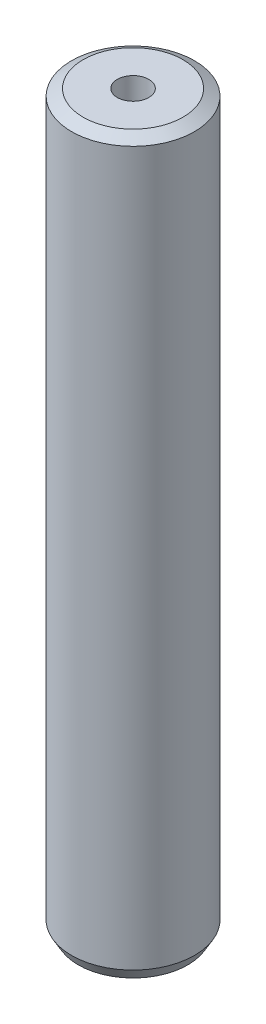
from build123d import *
from OCP.BRepFilletAPI import BRepFilletAPI_MakeChamfer

# Parameters (mm, degrees)
SKETCH1_R           = 7.5
BOSS_EXTRUDE1_DEPTH = 89.245535835
SKETCH2_R           = 1.921418219
CUT_EXTRUDE1_DEPTH  = 90.873609399
CHAMFER1_SIZE       = 0.815649787
CHAMFER1_SIZE2      = 1.412746872


with BuildPart() as part:
    # Sketch1 → Boss-Extrude1 (new body)
    with BuildSketch(Plane(origin=(0, 0, 0), x_dir=(1, 0, 0), z_dir=(0, 1, 0))):
        Circle(SKETCH1_R)
    extrude(amount=BOSS_EXTRUDE1_DEPTH)

    # Sketch2 → Cut-Extrude1 (cut, through all)
    with BuildSketch(Plane(origin=(0, 0, 0), x_dir=(1, 0, 0), z_dir=(0, 1, 0))):
        Circle(SKETCH2_R)
    extrude(amount=CUT_EXTRUDE1_DEPTH, mode=Mode.SUBTRACT)

    # Chamfer1: one chamfer whose edges measure the first distance from different faces: ONE call of the kernel's chamfer builder (chamfer() names one face for all edges)
    chamfer1_edges_1 = [part.edges().sort_by_distance(p)[0] for p in [
        (-7.5, 89.245535835, 0),
    ]]
    chamfer1_side_1 = [part.faces().sort_by_distance(p)[0] for p in [
        (-7.5, 44.622767917, 0),
    ]]
    chamfer1_edges_2 = [part.edges().sort_by_distance(p)[0] for p in [
        (-7.5, 0, 0),
    ]]
    chamfer1_side_2 = [part.faces().sort_by_distance(p)[0] for p in [
        (-7.287867966, 0, 0),
    ]]
    chamfer1 = BRepFilletAPI_MakeChamfer(part.part.solid().wrapped)
    for e in chamfer1_edges_1:
        chamfer1.Add(CHAMFER1_SIZE, CHAMFER1_SIZE2, e.wrapped, chamfer1_side_1[0].wrapped)  # the first distance lies on this face
    for e in chamfer1_edges_2:
        chamfer1.Add(CHAMFER1_SIZE, CHAMFER1_SIZE2, e.wrapped, chamfer1_side_2[0].wrapped)  # the first distance lies on this face
    add(Compound.cast(chamfer1.Shape()), mode=Mode.REPLACE)


solid = part.part
